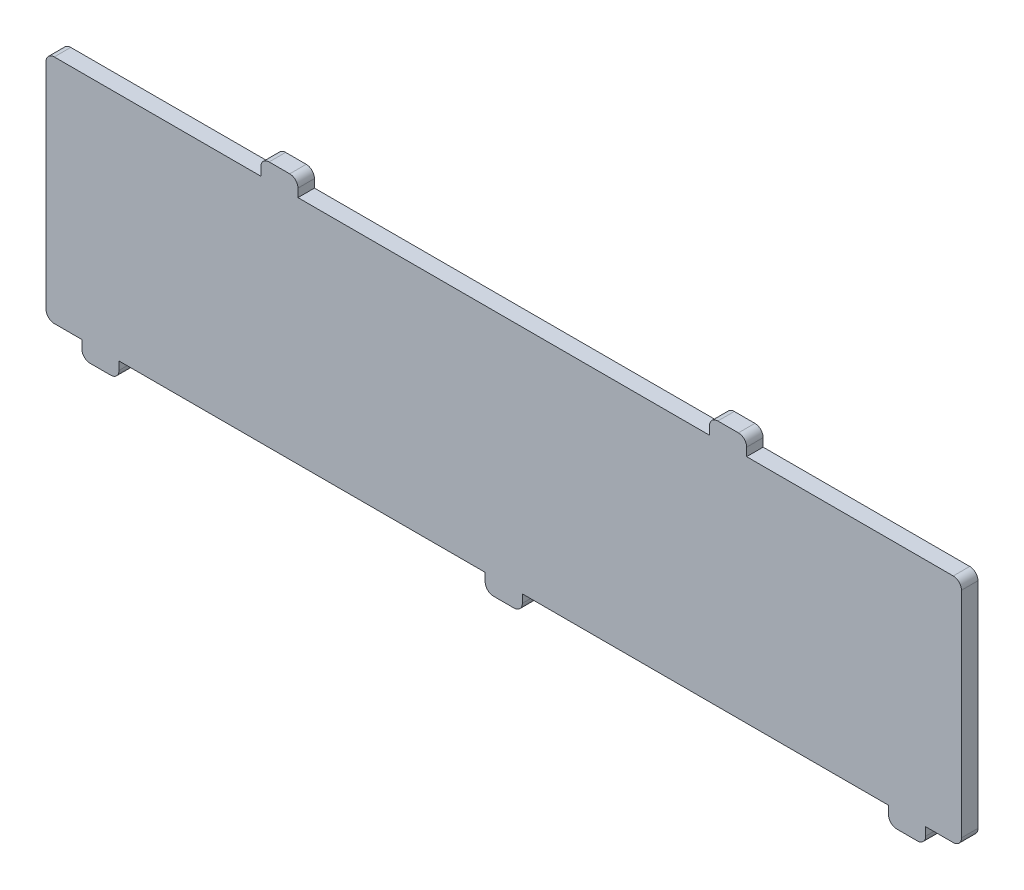
from build123d import *

# Parameters (mm, degrees)
BOSS_EXTRUDE1_DEPTH = 1
FILLET1_R           = 1


with BuildPart() as part:
    # Sketch1 → Boss-Extrude1 (new, symmetric)
    with BuildSketch(Plane.XY):
        Polygon((-29.45, 14), (-55.5, 14), (-55.5, -14), (-51.15, -14), (-51.15, -16), (-46.65, -16), (-46.65, -14), (-2.25, -14), (-2.25, -16), (2.25, -16), (2.25, -14), (46.65, -14), (46.65, -16), (51.15, -16), (51.15, -14), (55.5, -14), (55.5, 14), (29.45, 14), (29.45, 16), (24.95, 16), (24.95, 14), (-24.95, 14), (-24.95, 16), (-29.45, 16), align=None)
    extrude(amount=BOSS_EXTRUDE1_DEPTH, both=True)

    # Fillet1
    fillet1_edges = [part.edges().sort_by_distance(p)[0] for p in [
        (-55.5, 14, 0),
        (-55.5, -14, 0),
        (-46.65, -16, 0),
        (-51.15, -16, 0),
        (2.25, -16, 0),
        (-2.25, -16, 0),
        (46.65, -16, 0),
        (51.15, -16, 0),
        (55.5, -14, 0),
        (55.5, 14, 0),
        (29.45, 16, 0),
        (24.95, 16, 0),
        (-24.95, 16, 0),
        (-29.45, 16, 0),
    ]]
    fillet(fillet1_edges, radius=FILLET1_R)


solid = part.part
